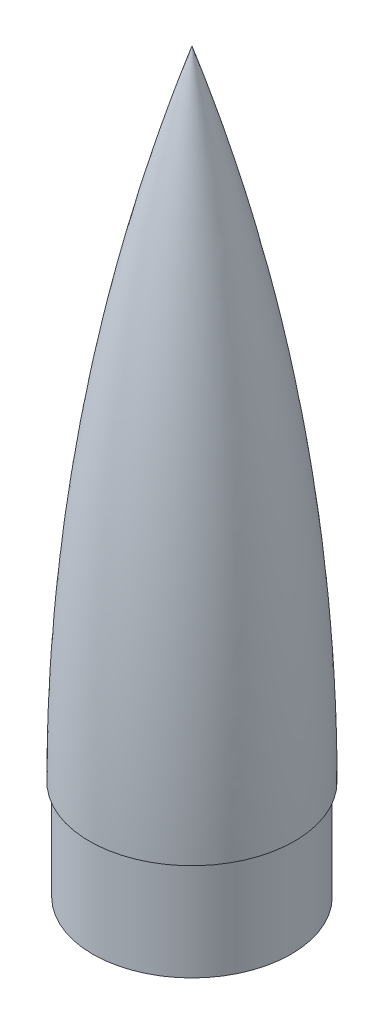
from build123d import *

# Parameters (mm, degrees)
SKETCH3_R           = 63.246
SKETCH3_R_2         = 55.626
BOSS_EXTRUDE1_DEPTH = 63.5


# Read off the part's stored shape, not the designer's step: Shell1
with BuildPart() as part:
    # Sketch2 → Revolve1 (revolve)
    with BuildSketch(Plane.XY):
        with BuildLine():
            Line((-1295.2984, 0), (-1229.8934, 0))
            Line((-1229.8934, 0), (-1229.8934, 406.399027655))
            ThreePointArc((-1229.8934, 406.399027655), (-1278.842620934, 205.814226734), (-1295.2984, 0))
        make_face()
    revolve(axis=Axis((-1229.8934, 0, 0), (0, 1, 0)))

    # Shell1 outline → Shell1 (revolve, cut)
    with BuildSketch(Plane(origin=(-1229.8934, 0, 0), x_dir=(1, 0, 0), z_dir=(0, 0, 1))):
        with BuildLine():
            add(Edge.make_bspline(
                [(0, 381.415634791), (57.785, 195.085071394), (57.785, 0)],
                knots=[5.982469351, 5.982469351, 5.982469351, 6.283185307, 6.283185307, 6.283185307], degree=2, weights=[1, 0.988717519, 1]))
            Line((0, 381.415634791), (0, -1e-07))
            Line((0, -1e-07), (57.785, 0))
        make_face()
    revolve(axis=Axis((-1229.8934, 0, 0), (0, 1, 0)), mode=Mode.SUBTRACT)

    # Sketch3 → Boss-Extrude1 (add)
    with BuildSketch(Plane.XZ):
        with Locations(Location((-1229.8934, 0, 0), (0, 0, 270))):
            Circle(SKETCH3_R)
        with Locations(Location((-1229.8934, 0, 0), (0, 0, 270))):
            Circle(SKETCH3_R_2, mode=Mode.SUBTRACT)
    extrude(amount=BOSS_EXTRUDE1_DEPTH)


solid = part.part
